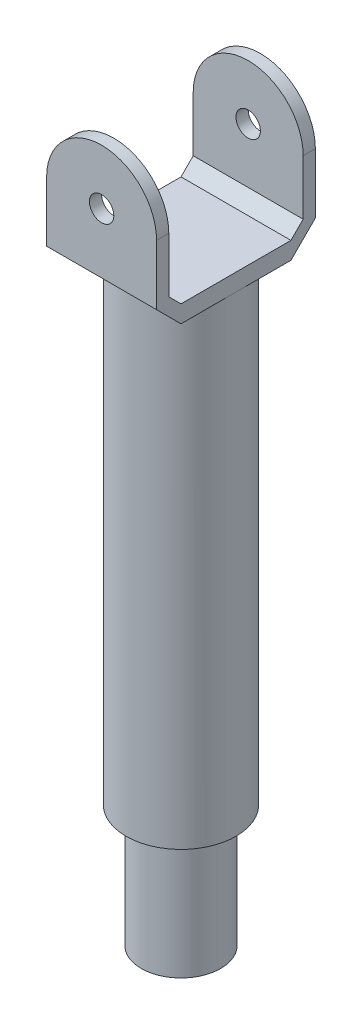
from build123d import *

# Parameters (mm, degrees)
SKETCH1_R               = 32.5
BOSS_EXTRUDE1_DEPTH     = 100
SKETCH2_R               = 45
BOSS_EXTRUDE2_DEPTH     = 400
BOSS_EXTRUDE3_DEPTH     = 45
CUT_EXTRUDE2_DEPTH      = 616.568842616
CUT_EXTRUDE2_DEPTH_BACK = 616.568842616
SKETCH7_R               = 10


with BuildPart() as part:
    # Sketch1 → Boss-Extrude1 (new body)
    with BuildSketch(Plane(origin=(0, 0, 0), x_dir=(1, 0, 0), z_dir=(0, 1, 0))):
        Circle(SKETCH1_R)
    extrude(amount=BOSS_EXTRUDE1_DEPTH)

    # Sketch2 → Boss-Extrude2 (add)
    with BuildSketch(Plane(origin=(0, 100, 0), x_dir=(1, 0, 0), z_dir=(0, 1, 0))):
        Circle(SKETCH2_R)
    extrude(amount=BOSS_EXTRUDE2_DEPTH)

    # Sketch6 → Boss-Extrude3 (add, symmetric)
    with BuildSketch(Plane(origin=(0, 0, 0), x_dir=(0, 0, -1), z_dir=(1, 0, 0))):
        Polygon((-45, 500), (-55, 510), (-55, 600), (-65, 600), (-65, 505.857864376), (-45, 485.857864376), (45, 485.857864376), (65, 505.857864376), (65, 600), (55, 600), (55, 510), (45, 500), align=None)
    extrude(amount=BOSS_EXTRUDE3_DEPTH, both=True)

    # Sketch7 → Cut-Extrude2 (cut, two sides: drawn at the far end of the back side and taken through both)
    with BuildSketch(Plane.XY.offset(65).offset(-CUT_EXTRUDE2_DEPTH_BACK)):
        with Locations((0, 555)):
            Circle(SKETCH7_R)
        with BuildLine():
            Line((-45, 555), (-45, 605))
            Line((-45, 605), (45, 605))
            Line((45, 605), (45, 555))
            ThreePointArc((45, 555), (0, 600), (-45, 555))
        make_face()
    extrude(amount=CUT_EXTRUDE2_DEPTH + CUT_EXTRUDE2_DEPTH_BACK, mode=Mode.SUBTRACT)


solid = part.part
